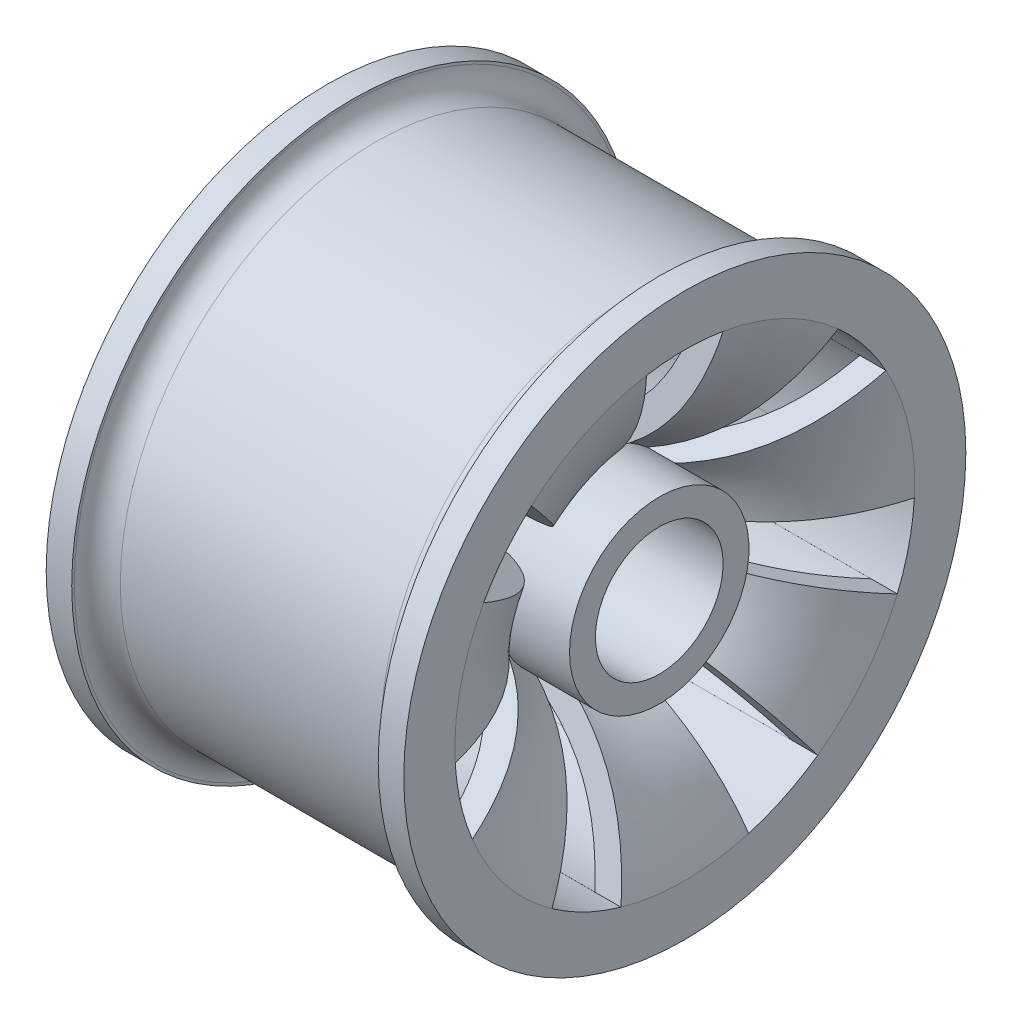
from build123d import *
from build123d.topology import SkipClean

# Parameters (mm, degrees)
SKETCH3_R           = 3.512937447
SKETCH3_R_2         = 2.5
BOSS_EXTRUDE3_DEPTH = 13
SKETCH5_R           = 2.5
CUT_EXTRUDE9_DEPTH  = 21.930995525


with BuildPart() as part:
    # Sketch1 → Revolve1 (revolve)
    with BuildSketch(Plane.XY):
        with BuildLine():
            Line((-5.977318778, 9), (5.977318778, 9))
            add(Edge.make_bspline(
                [(5.977318778, 9), (5.971811367, 8.975222227), (5.562087836, 7.215033632), (4.069266539, 5.252557202), (1.935066771, 3.855081597), (0.019003444, 3.516133425), (0, 3.512937447)],
                knots=[0.019778015, 0.019778015, 0.019778015, 0.024722519, 0.375, 0.625, 0.982243258, 0.985794607, 0.985794607, 0.985794607], degree=2))
            Line((0, 3.512937447), (0, 2.5))
            add(Edge.make_bspline(
                [(6.999999581, 9.002422396), (5.87124706, 3.409561407), (0, 2.5)],
                knots=[0, 0, 0, 1, 1, 1], degree=2))
            Line((6.999999581, 9.002422396), (6.999999581, 11.002422396))
            Line((6.999999581, 11.002422396), (5.999999581, 11.002422396))
            Line((5.999999581, 11.002422396), (5.999999581, 10.9))
            ThreePointArc((5.999999581, 10.9), (5.736395684, 10.263603897), (5.099999581, 10))
            Line((5.099999581, 10), (-5.099999581, 10))
            ThreePointArc((-5.099999581, 10), (-5.736395684, 10.263603897), (-5.999999581, 10.9))
            Line((-5.999999581, 10.9), (-5.999999581, 11.002422396))
            Line((-5.999999581, 11.002422396), (-6.999999581, 11.002422396))
            Line((-6.999999581, 11.002422396), (-6.999999581, 9.002422396))
            Line((-6.999999581, 9.002422396), (-5.977318778, 9))
        make_face()
    revolve(axis=Axis((0, 0, 0), (1, 0, 0)))

    # Sketch3 → Boss-Extrude3 (add)
    with BuildSketch(Plane.ZY.offset(6.999999581)):
        Circle(SKETCH3_R)
        Circle(SKETCH3_R_2, mode=Mode.SUBTRACT)
    extrude(amount=-BOSS_EXTRUDE3_DEPTH)

    # Sketch5 → Cut-Extrude9 (cut, through all)
    with SkipClean():  # the faces are left unmerged after this step: merging them gives an invalid solid
        with BuildSketch(Plane(origin=(6.999999581, 0, 0), x_dir=(0, 0, -1), z_dir=(1, 0, 0))):
            with BuildLine():
                Line((-1.5, 8.876576423), (-0.585332029, 3.463829661))
                ThreePointArc((-0.585332029, 3.463829661), (0, 3.512937447), (0.585332029, 3.463829661))
                Line((0.585332029, 3.463829661), (1.5, 8.876576423))
                ThreePointArc((1.5, 8.876576423), (0, 9.002422396), (-1.5, 8.876576423))
            make_face()
            with BuildLine():
                ThreePointArc((-3.07307963, 1.702031461), (-2.746525092, 2.190280673), (-2.343182528, 2.617293478))
                Line((-2.343182528, 2.617293478), (-6.004752201, 6.707202099))
                ThreePointArc((-6.004752201, 6.707202099), (-7.038377248, 5.612918556), (-7.875221607, 4.361707651))
                Line((-7.875221607, 4.361707651), (-3.07307963, 1.702031461))
            make_face()
            with BuildLine():
                Line((6.004752201, 6.707202099), (2.343182528, 2.617293478))
                ThreePointArc((2.343182528, 2.617293478), (2.746525092, 2.190280673), (3.07307963, 1.702031461))
                Line((3.07307963, 1.702031461), (7.875221607, 4.361707651))
                ThreePointArc((7.875221607, 4.361707651), (7.038377248, 5.612918556), (6.004752201, 6.707202099))
            make_face()
            with BuildLine():
                ThreePointArc((-3.24673559, -1.341431145), (-3.424860771, -0.781702122), (-3.50723285, -0.200118078))
                Line((-3.50723285, -0.200118078), (-8.98780352, -0.512832208))
                ThreePointArc((-8.98780352, -0.512832208), (-8.776712871, -2.003227439), (-8.320240718, -3.437615944))
                Line((-8.320240718, -3.437615944), (-3.24673559, -1.341431145))
            make_face()
            with BuildLine():
                Line((8.98780352, -0.512832208), (3.50723285, -0.200118078))
                ThreePointArc((3.50723285, -0.200118078), (3.424860771, -0.781702122), (3.24673559, -1.341431145))
                Line((3.24673559, -1.341431145), (8.320240718, -3.437615944))
                ThreePointArc((8.320240718, -3.437615944), (8.776712871, -2.003227439), (8.98780352, -0.512832208))
            make_face()
            with BuildLine():
                ThreePointArc((-0.975533429, -3.374768738), (-1.524206435, -3.165047275), (-2.030265301, -2.866836639))
                Line((-2.030265301, -2.866836639), (-5.202855471, -7.346693402))
                ThreePointArc((-5.202855471, -7.346693402), (-3.90600469, -8.110902314), (-2.499948867, -8.648344619))
                Line((-2.499948867, -8.648344619), (-0.975533429, -3.374768738))
            make_face()
            with BuildLine():
                Line((5.202855471, -7.346693402), (2.030265301, -2.866836639))
                ThreePointArc((2.030265301, -2.866836639), (1.524206435, -3.165047275), (0.975533429, -3.374768738))
                Line((0.975533429, -3.374768738), (2.499948867, -8.648344619))
                ThreePointArc((2.499948867, -8.648344619), (3.90600469, -8.110902314), (5.202855471, -7.346693402))
            make_face()
            Circle(SKETCH5_R)
        extrude(amount=-CUT_EXTRUDE9_DEPTH, mode=Mode.SUBTRACT)
    add(part.part.scale(1), mode=Mode.REPLACE)  # the faces are merged on a copy


solid = part.part
